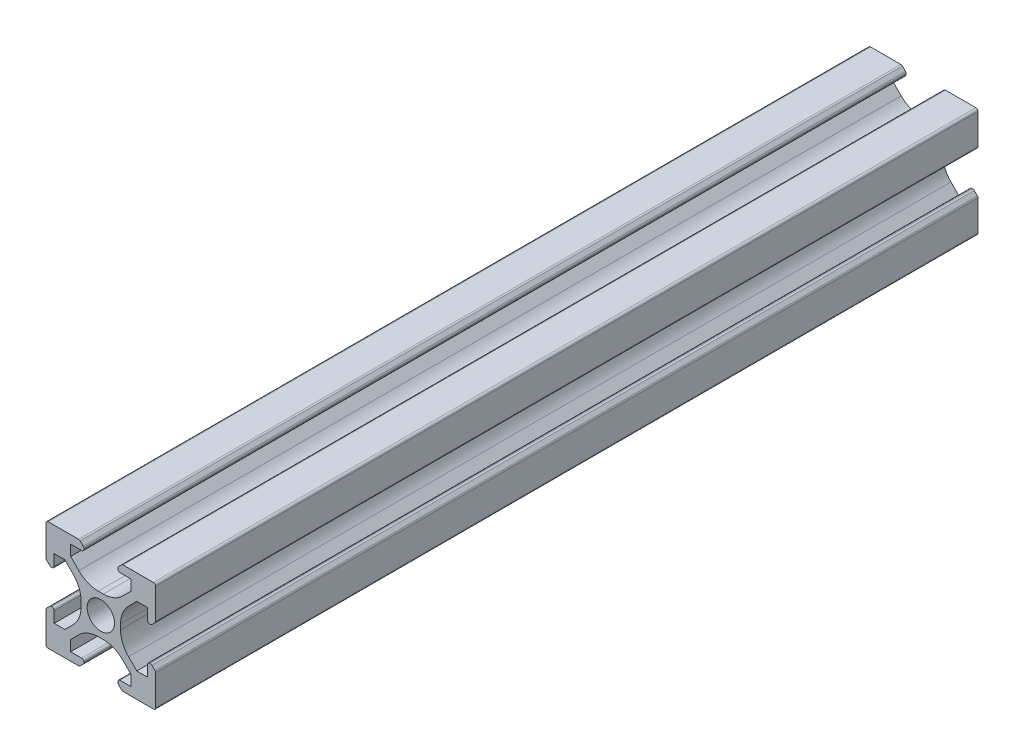
from build123d import *

# Parameters (mm, degrees)
RESSALTO_EXTRUS_O1_DEPTH = 150
PADR_OCIRCULAR1_COUNT    = 4
FILETE1_R                = 0.4


with BuildPart() as part:
    # Esboço1 → Ressalto-extrusão1 (new body)
    with BuildSketch(Plane.XY):
        with BuildLine():
            ThreePointArc((-9.317157288, 3.217157288), (-9.187387948, 3.130448187), (-9.034314575, 3.1))
            Line((-9.034314575, 3.1), (-8.9, 3.1))
            ThreePointArc((-8.9, 3.1), (-8.617157288, 3.217157288), (-8.5, 3.5))
            Line((-8.5, 3.5), (-8.5, 5.5))
            Line((-8.5, 5.5), (-6.560660172, 5.5))
            Line((-6.560660172, 5.5), (-5.064466094, 4.003805922))
            ThreePointArc((-5.064466094, 4.003805922), (-3.980602337, 2.381689178), (-3.6, 0.468272016))
            Line((-3.6, 0.468272016), (-3.6, 0))
            Line((-3.6, 0), (-2.5, 0))
            ThreePointArc((-2.5, 0), (-1.767766953, 1.767766953), (0, 2.5))
            Line((0, 2.5), (0, 3.6))
            Line((0, 3.6), (-0.468272016, 3.6))
            ThreePointArc((-0.468272016, 3.6), (-2.381689178, 3.980602337), (-4.003805922, 5.064466094))
            Line((-4.003805922, 5.064466094), (-5.5, 6.560660172))
            Line((-5.5, 6.560660172), (-5.5, 8.5))
            Line((-5.5, 8.5), (-3.5, 8.5))
            ThreePointArc((-3.5, 8.5), (-3.217157288, 8.617157288), (-3.1, 8.9))
            Line((-3.1, 8.9), (-3.1, 9.034314575))
            ThreePointArc((-3.1, 9.034314575), (-3.130448187, 9.187387948), (-3.217157288, 9.317157288))
            Line((-3.217157288, 9.317157288), (-3.782842712, 9.882842712))
            ThreePointArc((-3.782842712, 9.882842712), (-3.912612052, 9.969551813), (-4.065685425, 10))
            Line((-4.065685425, 10), (-10, 10))
            Line((-10, 10), (-10, 4.065685425))
            ThreePointArc((-10, 4.065685425), (-9.969551813, 3.912612052), (-9.882842712, 3.782842712))
            Line((-9.882842712, 3.782842712), (-9.317157288, 3.217157288))
        make_face()
    ressalto_extrus_o1 = extrude(amount=RESSALTO_EXTRUS_O1_DEPTH)

    # PadrãoCircular1: Ressalto-extrusão1 ×4 about axis
    padr_ocircular1_axis = Axis((0, 0, 0), (0, 0, 1))
    for i in range(1, PADR_OCIRCULAR1_COUNT):
        add(ressalto_extrus_o1.rotate(padr_ocircular1_axis, i * 360 / PADR_OCIRCULAR1_COUNT))

    # Filete1
    filete1_edges = [part.edges().sort_by_distance(p)[0] for p in [
        (-10, -10, 75),
        (-10, 10, 75),
        (10, -10, 75),
        (10, 10, 75),
    ]]
    fillet(filete1_edges, radius=FILETE1_R)


solid = part.part
